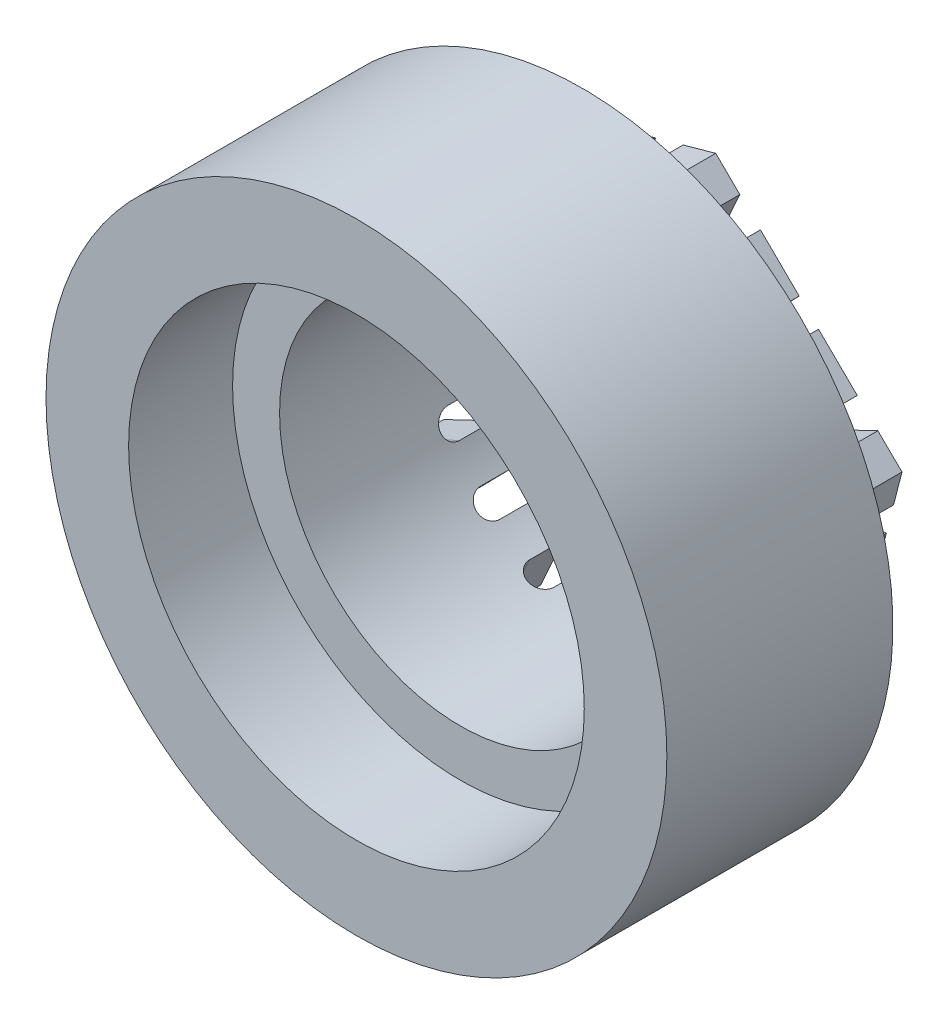
from build123d import *

# Parameters (mm, degrees)
SKETCH1_R           = 21.79955
BOSS_EXTRUDE1_DEPTH = 20.6502
SKETCH2_R           = 12.7
CUT_EXTRUDE1_DEPTH  = 20.6502
SKETCH3_R           = 16.000000004
CUT_EXTRUDE2_DEPTH  = 7.3025
SKETCH4_OUTSIDE_W   = 58.604
SKETCH4_OUTSIDE_H   = 58.604
CUT_EXTRUDE3_DEPTH  = 4.7752
CUT_EXTRUDE4_DEPTH  = 9.8552
CIRPATTERN1_COUNT   = 18


with BuildPart() as part:
    # Sketch1 → Boss-Extrude1 (new body)
    with BuildSketch(Plane.XY):
        Circle(SKETCH1_R)
    extrude(amount=BOSS_EXTRUDE1_DEPTH)

    # Sketch2 → Cut-Extrude1 (cut)
    with BuildSketch(Plane.XY.offset(20.6502)):
        Circle(SKETCH2_R)
    extrude(amount=-CUT_EXTRUDE1_DEPTH, mode=Mode.SUBTRACT)

    # Sketch3 → Cut-Extrude2 (cut)
    with BuildSketch(Plane.XY.offset(20.6502)):
        Circle(SKETCH3_R)
    extrude(amount=-CUT_EXTRUDE2_DEPTH, mode=Mode.SUBTRACT)

    # Sketch4 outside → Cut-Extrude3 (cut)
    with BuildSketch(Plane(origin=(0, 0, 0), x_dir=(-1, 0, 0), z_dir=(0, 0, -1))):
        Rectangle(SKETCH4_OUTSIDE_W, SKETCH4_OUTSIDE_H)
        Polygon((17.661795398, -4.907322758), (13.080763872, 12.841902112), (-4.581031526, 17.74922487), (-17.661795398, 4.907322758), (-13.080763872, -12.841902112), (4.581031526, -17.74922487), align=None, mode=Mode.SUBTRACT)
    extrude(amount=-CUT_EXTRUDE3_DEPTH, mode=Mode.SUBTRACT)

    # Sketch5 → Cut-Extrude4 (cut, symmetric)
    with BuildSketch(Plane(origin=(-15.371279635, 3.967289677, 0), x_dir=(0, 0, 1), z_dir=(-0.9682695833030739, 0.24990801117629627, 0))):
        with BuildLine():
            Line((2.3876, 0.9525), (0, 0.9525))
            Line((0, 0.9525), (0, -0.9525))
            Line((0, -0.9525), (2.3876, -0.9525))
            ThreePointArc((2.3876, -0.9525), (3.3401, 0), (2.3876, 0.9525))
        make_face()
    cut_extrude4 = extrude(amount=CUT_EXTRUDE4_DEPTH, both=True, mode=Mode.SUBTRACT)

    # CirPattern1: Cut-Extrude4 ×18 about axis
    cirpattern1_axis = Axis((0, 0, 13.3477), (0, 0, 1))
    for i in range(1, CIRPATTERN1_COUNT):
        add(cut_extrude4.rotate(cirpattern1_axis, i * 360 / CIRPATTERN1_COUNT), mode=Mode.SUBTRACT)


solid = part.part
